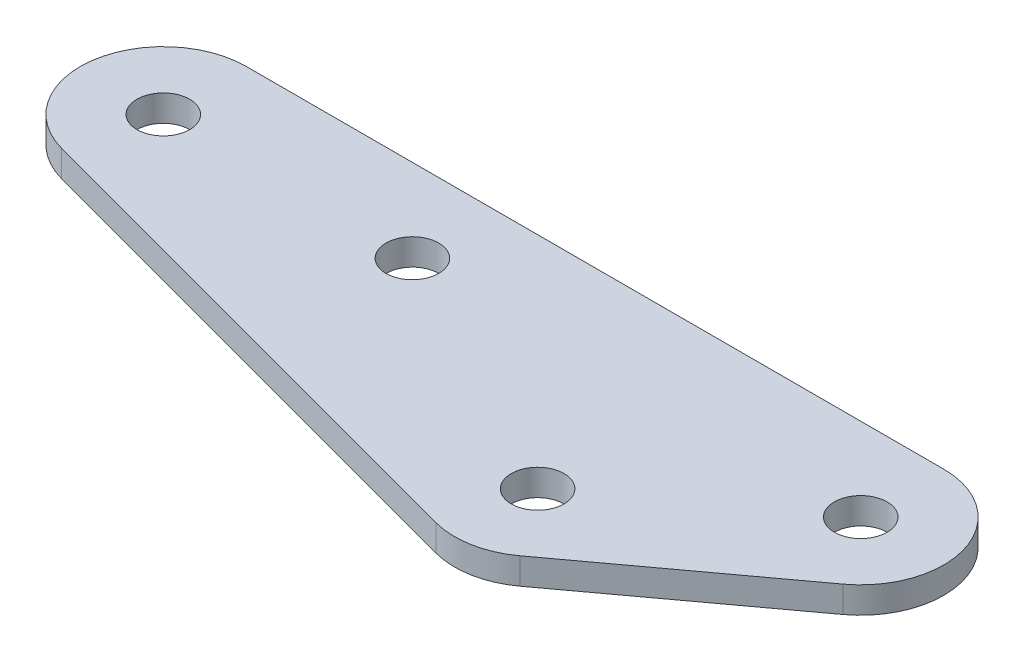
from build123d import *

# Parameters (mm, degrees)
SKETCH1_R           = 1.5875
BOSS_EXTRUDE1_DEPTH = 0.79375


with BuildPart() as part:
    # Sketch1 → Boss-Extrude1 (new, symmetric)
    with BuildSketch(Plane(origin=(0, 0, 0), x_dir=(1, 0, 0), z_dir=(0, 1, 0))):
        with BuildLine():
            ThreePointArc((23.964571931, -4.026327516), (25.750349333, 1.560186274), (21, 5))
            Line((21, 5), (-21, 5))
            ThreePointArc((-21, 5), (-25.957224307, 0.652630961), (-22.294095226, -4.829629131))
            Line((-22.294095226, -4.829629131), (8.499620117, -13.080780289))
            ThreePointArc((8.499620117, -13.080780289), (10.720508996, -13.164505768), (12.758287273, -12.277478674))
            Line((12.758287273, -12.277478674), (23.964571931, -4.026327516))
        make_face()
        with Locations((9.793715342, -8.251151158)):
            Circle(SKETCH1_R, mode=Mode.SUBTRACT)
        with Locations((-21, 0)):
            Circle(SKETCH1_R, mode=Mode.SUBTRACT)
        with Locations((-6, 0)):
            Circle(SKETCH1_R, mode=Mode.SUBTRACT)
        with Locations((21, 0)):
            Circle(SKETCH1_R, mode=Mode.SUBTRACT)
    extrude(amount=BOSS_EXTRUDE1_DEPTH, both=True)


solid = part.part
